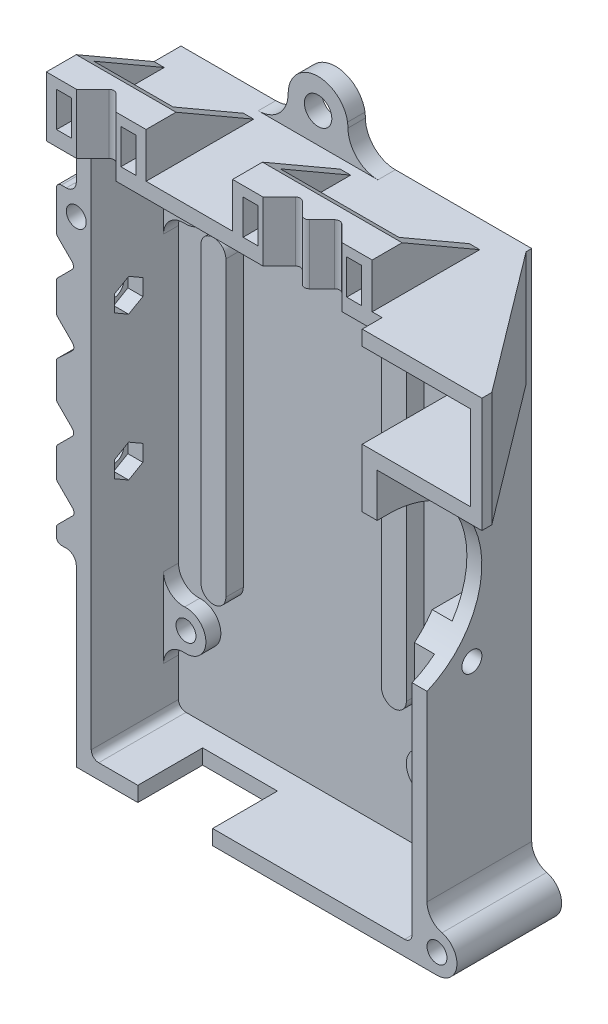
from build123d import *

# Parameters (mm, degrees)
BOSS_EXTRUDE1_DEPTH             = 21
BOSS_EXTRUDE2_DEPTH             = 3.5
BOSS_EXTRUDE3_DEPTH             = 21
CUT_EXTRUDE1_DEPTH              = 152.534444291
CUT_EXTRUDE1_DEPTH_BACK         = 152.534444291
SKETCH10_R                      = 2.750000171
SKETCH10_R_2                    = 1.99999852
BOSS_EXTRUDE4_DEPTH             = 7
SKETCH12_W                      = 20.722732544
SKETCH12_H                      = 16.999992371
BOSS_EXTRUDE5_DEPTH             = 29.86794
SKETCH11_3_W                    = 4.000002191
SKETCH11_3_H                    = 12
BOSS_EXTRUDE7_DEPTH             = 16.5
CUT_EXTRUDE2_DEPTH              = 152.049314388
SKETCH16_W                      = 5
SKETCH16_H                      = 16.999992371
BOSS_EXTRUDE9_DEPTH             = 3.5
CUT_EXTRUDE3_REACH              = 163.611
SKETCH11_4_R                    = 4.000002191
BOSS_EXTRUDE10_DEPTH            = 6.5
CUT_EXTRUDE5_DEPTH              = 161.9765096
CUT_EXTRUDE5_DEPTH_BACK         = 161.9765096
SKETCH20_R                      = 1.99999852
CUT_EXTRUDE6_START              = -7.000001
CUT_EXTRUDE6_DEPTH              = 7.000001
BOSS_EXTRUDE12_START            = -3.00000066
BOSS_EXTRUDE12_DEPTH            = 3.00000066
CUT_EXTRUDE7_REACH              = 152.189
SKETCH27_R                      = 1.999999364
CUT_EXTRUDE8_REACH              = 154.382
SKETCH29_W                      = 15.000001908
SKETCH29_H                      = 13
CUT_EXTRUDE10_START             = -3
SKETCH32_R                      = 1.99999852
CUT_EXTRUDE10_DEPTH             = 3
SKETCH34_R                      = 2.750000482
BOSS_EXTRUDE13_DEPTH            = 3.5
SKETCH36_W                      = 2.999998569
SKETCH36_H                      = 6.999977112
SKETCH36_W_2                    = 2.99999857
BOSS_EXTRUDE15_DEPTH            = 21.58846
SKETCH38_W                      = 23.798984527
SKETCH38_H                      = 6.999977112
SKETCH38_W_2                    = 15.899493694
CUT_EXTRUDE12_DEPTH             = 15.32436
CUT_EXTRUDE13_DEPTH             = 159.171800579
CUT_EXTRUDE14_REACH             = 171.467
SKETCH40_W                      = 23.798990726
SKETCH40_H                      = 2.000015259
SKETCH40_W_2                    = 15.899492264
CUT_EXTRUDE16_DEPTH             = 169.972465585
CUT_EXTRUDE16_DEPTH_BACK        = 2.999999
SKETCH41_R                      = 2.000001006
CUT_EXTRUDE17_REACH             = 163.611
CUT_EXTRUDE17_DIRECTION_2_REACH = 163.611
CUT_EXTRUDE18_START             = -3
SKETCH43_R                      = 1.999999364
SKETCH43_R_2                    = 1.99999852
CUT_EXTRUDE18_DEPTH             = 3
SKETCH44_R                      = 2.000001006
CUT_EXTRUDE19_DEPTH             = 3


with BuildPart() as part:
    # Sketch6 → Boss-Extrude1 (new body)
    with BuildSketch(Plane.XY):
        Polygon((4.000000477, 126.750007629), (4.000000477, 69.375003814), (6.999999046, 69.375003814), (6.999999046, 123.749992371), (71.349998474, 123.749992371), (71.349998474, 69.375003814), (74.349999134, 69.375003814), (74.349999134, 126.750007629), align=None)
        with BuildLine():
            Line((4.000000477, 69.375003814), (4.000000477, 12))
            Line((4.000000477, 12), (23, 12))
            Line((23, 12), (46.721875813, 12))
            ThreePointArc((46.721875813, 12), (47.010937855, 12.006954424), (47.299999897, 12))
            Line((47.299999897, 12), (76.349993277, 12))
            ThreePointArc((76.349993277, 12), (80.318124781, 15.495998665), (77.34998614, 19.873009894))
            ThreePointArc((77.34998614, 19.873009894), (75.187718222, 21.296490978), (74.349999134, 23.745965957))
            Line((74.349999134, 23.745965957), (74.349999134, 69.375003814))
            Line((74.349999134, 69.375003814), (71.349998474, 69.375003814))
            Line((71.349998474, 69.375003814), (71.349998474, 16.5))
            ThreePointArc((71.349998474, 16.5), (70.910658134, 15.439338592), (69.849996726, 14.999998252))
            Line((69.849996726, 14.999998252), (8.500000794, 14.999998252))
            ThreePointArc((8.500000794, 14.999998252), (7.439339386, 15.439338592), (6.999999046, 16.5))
            Line((6.999999046, 16.5), (6.999999046, 69.375003814))
            Line((6.999999046, 69.375003814), (4.000000477, 69.375003814))
        make_face()
    extrude(amount=BOSS_EXTRUDE1_DEPTH)

    # Sketch6<4> → Boss-Extrude2 (add)
    with BuildSketch(Plane.XY):
        with BuildLine():
            Line((46.721875813, 12), (23, 12))
            ThreePointArc((23, 12), (27.242640687, 10.242640687), (29, 6))
            ThreePointArc((29, 6), (34.999004884, 8.2e-08), (40.99999967, 5.998009768))
            ThreePointArc((40.99999967, 5.998009768), (42.660251426, 10.143654928), (46.721875813, 12))
        make_face()
        with BuildLine():
            Line((6.999999046, 123.749992371), (6.999999046, 16.5))
            ThreePointArc((6.999999046, 16.5), (7.439339386, 15.439338592), (8.500000794, 14.999998252))
            Line((8.500000794, 14.999998252), (69.849996726, 14.999998252))
            ThreePointArc((69.849996726, 14.999998252), (70.910658134, 15.439338592), (71.349998474, 16.5))
            Line((71.349998474, 16.5), (71.349998474, 123.749992371))
            Line((71.349998474, 123.749992371), (6.999999046, 123.749992371))
        make_face()
    extrude(amount=BOSS_EXTRUDE2_DEPTH)

    # Sketch9 → Boss-Extrude3 (add)
    with BuildSketch(Plane.XY):
        with BuildLine():
            Line((1.000000477, 111.59794588), (2.000000477, 111.59794588))
            ThreePointArc((2.000000477, 111.59794588), (3.414214039, 112.183732318), (4.000000477, 113.59794588))
            Line((4.000000477, 113.59794588), (4.000000477, 47))
            ThreePointArc((4.000000477, 47), (3.414209007, 48.414204361), (2.000000477, 48.999985766))
            Line((2.000000477, 48.999985766), (1.000000477, 48.999985766))
            ThreePointArc((1.000000477, 48.999985766), (0.292893696, 49.292878985), (4.77e-07, 49.999985766))
            Line((4.77e-07, 49.999985766), (4.77e-07, 51.585770678))
            ThreePointArc((4.77e-07, 51.585770678), (0.074219319, 51.963829729), (0.285858415, 52.285770678))
            Line((0.285858415, 52.285770678), (3.181543207, 55.181455471))
            ThreePointArc((3.181543207, 55.181455471), (3.535611584, 55.94485074), (3.181543207, 56.70824601))
            Line((3.181543207, 56.70824601), (0.283195204, 59.606594013))
            ThreePointArc((0.283195204, 59.606594013), (0.07163308, 59.932133116), (4.77e-07, 60.313712742))
            Line((4.77e-07, 60.313712742), (4.77e-07, 65.485286381))
            ThreePointArc((4.77e-07, 65.485286381), (0.081930249, 65.83661782), (0.283195204, 66.136015024))
            Line((0.283195204, 66.136015024), (3.181543207, 69.034363027))
            ThreePointArc((3.181543207, 69.034363027), (3.474333043, 69.74136641), (3.181543207, 70.448369793))
            Line((3.181543207, 70.448369793), (0.180917309, 73.448995691))
            ThreePointArc((0.180917309, 73.448995691), (0.012306014, 73.812584237), (4.77e-07, 74.213177514))
            Line((4.77e-07, 74.213177514), (4.77e-07, 80.384754968))
            ThreePointArc((4.77e-07, 80.384754968), (0.02955487, 80.738636823), (0.180917309, 81.059876985))
            Line((0.180917309, 81.059876985), (3.181543207, 83.899626586))
            ThreePointArc((3.181543207, 83.899626586), (3.50528427, 84.636290587), (3.181543207, 85.372954587))
            Line((3.181543207, 85.372954587), (0.180917309, 88.373580485))
            ThreePointArc((0.180917309, 88.373580485), (0.017422211, 88.725227692), (4.77e-07, 89.11263302))
            Line((4.77e-07, 89.11263302), (4.77e-07, 94.284195215))
            ThreePointArc((4.77e-07, 94.284195215), (0.017398622, 94.671662533), (0.180917309, 95.023365897))
            Line((0.180917309, 95.023365897), (3.181543207, 98.023991795))
            ThreePointArc((3.181543207, 98.023991795), (3.427018788, 98.680263767), (3.181543207, 99.336535739))
            Line((3.181543207, 99.336535739), (0.180917309, 102.337161637))
            ThreePointArc((0.180917309, 102.337161637), (0.029576956, 102.658343409), (4.77e-07, 103.012160968))
            Line((4.77e-07, 103.012160968), (4.77e-07, 110.59794588))
            ThreePointArc((4.77e-07, 110.59794588), (0.292893696, 111.305052661), (1.000000477, 111.59794588))
        make_face()
    extrude(amount=BOSS_EXTRUDE3_DEPTH)

    # Sketch10 → Cut-Extrude1 (cut, two sides: drawn at the far end of the back side and taken through both)
    with BuildSketch(Plane.XY.offset(-CUT_EXTRUDE1_DEPTH_BACK)):
        with Locations((34.999999893, 5.999999829)):
            Circle(SKETCH10_R)
        with Locations((59.700001725, 31.200001297)):
            Circle(SKETCH10_R_2)
        with Locations((76.349998476, 15.999999982)):
            Circle(SKETCH10_R_2)
        with Locations((11.500000477, 32.200000352)):
            Circle(SKETCH10_R_2)
        with Locations((3.99999967, 107.59797485)):
            Circle(SKETCH10_R_2)
        with Locations((11.500000477, 106.799995647)):
            Circle(SKETCH10_R_2)
        with Locations((34.999999893, 132.750000299)):
            Circle(SKETCH10_R)
        with Locations((59.700001725, 113.899995079)):
            Circle(SKETCH10_R_2)
    extrude(amount=CUT_EXTRUDE1_DEPTH + CUT_EXTRUDE1_DEPTH_BACK, mode=Mode.SUBTRACT)

    # Sketch11 → Boss-Extrude4 (add)
    with BuildSketch(Plane.XY):
        with BuildLine():
            Line((20.000006353, 101.249999523), (20.000006353, 42.5))
            ThreePointArc((20.000006353, 42.5), (17.500006353, 40), (15.000006353, 42.5))
            Line((15.000006353, 42.5), (15.000006353, 101.249999523))
            ThreePointArc((15.000006353, 101.249999523), (17.500006353, 103.749999523), (20.000006353, 101.249999523))
        make_face()
        with BuildLine():
            Line((56.199997425, 42.5), (56.199997425, 101.249999523))
            ThreePointArc((56.199997425, 101.249999523), (53.699997425, 103.749999523), (51.199997425, 101.249999523))
            Line((51.199997425, 101.249999523), (51.199997425, 42.5))
            ThreePointArc((51.199997425, 42.5), (53.699997425, 40), (56.199997425, 42.5))
        make_face()
    extrude(amount=BOSS_EXTRUDE4_DEPTH)

    # Sketch12 → Boss-Extrude5 (add)
    with BuildSketch(Plane.XY.offset(1.13206)):
        Polygon((71.349998474, 95), (71.349998474, 106.75), (93.100700378, 106.75), (93.100700378, 123.749992371), (71.349998474, 123.749992371), (71.349998474, 126.750007629), (95.349998474, 126.750007629), (95.349998474, 103.75), (74.349998474, 103.75), (74.349998474, 95), align=None)
        with Locations((82.739334106, 115.249996186)):
            Rectangle(SKETCH12_W, SKETCH12_H)
    extrude(amount=BOSS_EXTRUDE5_DEPTH)

    # Sketch11<3> → Boss-Extrude7 (add)
    with BuildSketch(Plane.XY):
        with Locations((69.349999569, 93)):
            Rectangle(SKETCH11_3_W, SKETCH11_3_H)
        with Locations((69.349999569, 61)):
            Rectangle(SKETCH11_3_W, SKETCH11_3_H)
    extrude(amount=BOSS_EXTRUDE7_DEPTH)

    # Sketch17 → Cut-Extrude2 (cut, through all)
    with BuildSketch(Plane(origin=(44.481818058, 0, -33.519447952), x_dir=(0.6018149521367547, 0, 0.79863556356115), z_dir=(-0.79863556356115, 0, 0.6018149521367547))):
        Polygon((80.787096013, 106.75), (80.787096013, 123.749992371), (68.315845718, 123.749992371), (67.697198387, 123.749992371), (44.462246624, 123.749992371), (44.462246624, 106.75), (67.697198387, 106.75), (68.315845718, 106.75), align=None)
    extrude(amount=CUT_EXTRUDE2_DEPTH, mode=Mode.SUBTRACT)

    # Sketch16 → Boss-Extrude9 (add)
    with BuildSketch(Plane.XY.offset(3.5)):
        with Locations((69.877967834, 115.249996186)):
            Rectangle(SKETCH16_W, SKETCH16_H)
    extrude(amount=-BOSS_EXTRUDE9_DEPTH)

    # Sketch18 → Cut-Extrude3 (cut, up to next)
    with BuildSketch(Plane(origin=(0, 126.750007629, 0), x_dir=(1, 0, 0), z_dir=(0, 1, 0)), mode=Mode.PRIVATE) as cut_extrude3_sk1:
        Polygon((95.349998474, -29), (74.349999134, -1.13206), (95.349998474, -1.13206), align=None)
    cut_extrude3_tool1 = extrude(cut_extrude3_sk1.sketch, amount=-CUT_EXTRUDE3_REACH, mode=Mode.PRIVATE) & part.part
    add(cut_extrude3_tool1.solids().sort_by_distance((88.349999, 126.750008, 10.421373))[0], mode=Mode.SUBTRACT)


with BuildPart() as boss_extrude10_tool:
    # Sketch11<4> → Boss-Extrude10 (new body)
    with BuildSketch(Plane.XY):
        with BuildLine():
            Line((7.000001972, 40.184359767), (7.000001972, 24.215635257))
            ThreePointArc((7.000001972, 24.215635257), (8.261395207, 27.131117809), (11.2500189, 28.207816384))
            ThreePointArc((11.2500189, 28.207816384), (15.500035829, 32.199997512), (11.2500189, 36.19217864))
            ThreePointArc((11.2500189, 36.19217864), (8.261395207, 37.268877215), (7.000001972, 40.184359767))
        make_face()
        with Locations((59.700001391, 31.20000078)):
            Circle(SKETCH11_4_R)
        with Locations((59.700001391, 113.900000509)):
            Circle(SKETCH11_4_R)
        with BuildLine():
            Line((7.000001972, 114.784361367), (7.000001972, 98.815636856))
            ThreePointArc((7.000001972, 98.815636856), (8.261395207, 101.731119408), (11.2500189, 102.807817984))
            ThreePointArc((11.2500189, 102.807817984), (15.500035829, 106.799999111), (11.2500189, 110.792180239))
            ThreePointArc((11.2500189, 110.792180239), (8.261395207, 111.868878814), (7.000001972, 114.784361367))
        make_face()
    extrude(amount=BOSS_EXTRUDE10_DEPTH)


with BuildPart() as part_1:
    add(part.part)


with BuildPart() as part_2:
    # Boss-Extrude10: joined with boss_extrude10_tool
    add(part_1.part.fuse(boss_extrude10_tool.part, tol=0.00001))

    # Sketch20 → Cut-Extrude5 (cut, two sides: drawn at the far end of the back side and taken through both)
    with BuildSketch(Plane.XY.offset(3.5).offset(-CUT_EXTRUDE5_DEPTH_BACK)):
        with Locations((11.500000477, 106.799995647)):
            Circle(SKETCH20_R)
        with Locations((11.500000477, 32.200000352)):
            Circle(SKETCH20_R)
        with Locations((59.700001725, 31.200001297)):
            Circle(SKETCH20_R)
        with Locations((59.700001725, 113.899995079)):
            Circle(SKETCH20_R)
    extrude(amount=CUT_EXTRUDE5_DEPTH + CUT_EXTRUDE5_DEPTH_BACK, mode=Mode.SUBTRACT)

    # Sketch23 → Cut-Extrude6 (cut)
    with BuildSketch(Plane(origin=(74.349999134, 0, 0), x_dir=(0, 0, -1), z_dir=(1, 0, 0)).offset(CUT_EXTRUDE6_START)):
        with BuildLine():
            Line((-31, 94.908846334), (-31, 23.654812291))
            Line((-31, 23.654812291), (-21, 23.654812291))
            Line((-21, 23.654812291), (-21, 60.32572408))
            ThreePointArc((-21, 60.32572408), (-10.000578453, 76.625954319), (-20.548913002, 93.221659139))
            ThreePointArc((-20.548913002, 93.221659139), (-25.662172256, 94.760784574), (-31, 94.908846334))
        make_face()
    extrude(amount=CUT_EXTRUDE6_DEPTH, mode=Mode.SUBTRACT)

    # Sketch25 → Boss-Extrude12 (add)
    with BuildSketch(Plane(origin=(74.349999134, 0, 0), x_dir=(0, 0, -1), z_dir=(1, 0, 0)).offset(BOSS_EXTRUDE12_START)):
        with BuildLine():
            ThreePointArc((-28.000590684, 95), (-24.429650305, 94.522367443), (-21, 93.419078343))
            Line((-21, 93.419078343), (-21, 95))
            Line((-21, 95), (-28.000590684, 95))
        make_face()
    extrude(amount=BOSS_EXTRUDE12_DEPTH)

    # Sketch27 → Cut-Extrude7 (cut, up to next)
    with BuildSketch(Plane(origin=(74.349999134, 0, 0), x_dir=(0, 0, -1), z_dir=(1, 0, 0)), mode=Mode.PRIVATE) as cut_extrude7_sk1:
        with Locations((-11.999999994, 92.999997362)):
            Circle(SKETCH27_R)
    cut_extrude7_tool1 = extrude(cut_extrude7_sk1.sketch, amount=-CUT_EXTRUDE7_REACH, mode=Mode.PRIVATE) & part_2.part
    # Sketch27 → Cut-Extrude7 (cut, up to next)
    with BuildSketch(Plane(origin=(74.349999134, 0, 0), x_dir=(0, 0, -1), z_dir=(1, 0, 0)), mode=Mode.PRIVATE) as cut_extrude7_sk2:
        with Locations((-11.999999994, 60.999997958)):
            Circle(SKETCH27_R)
    cut_extrude7_tool2 = extrude(cut_extrude7_sk2.sketch, amount=-CUT_EXTRUDE7_REACH, mode=Mode.PRIVATE) & part_2.part
    add(cut_extrude7_tool1.solids().sort_by_distance((74.349999, 92.999997, 12))[0], mode=Mode.SUBTRACT)
    add(cut_extrude7_tool2.solids().sort_by_distance((74.349999, 60.999998, 12))[0], mode=Mode.SUBTRACT)

    # Sketch29 → Cut-Extrude8 (cut, up to next)
    with BuildSketch(Plane.XZ.offset(-12), mode=Mode.PRIVATE) as cut_extrude8_sk1:
        with Locations((23.842785448, 14.5)):
            Rectangle(SKETCH29_W, SKETCH29_H)
    cut_extrude8_tool1 = extrude(cut_extrude8_sk1.sketch, amount=-CUT_EXTRUDE8_REACH, mode=Mode.PRIVATE) & part_2.part
    add(cut_extrude8_tool1.solids().sort_by_distance((23.842785, 12, 14.5))[0], mode=Mode.SUBTRACT)

    # Sketch32 → Cut-Extrude10 (cut)
    # profile 1 of 4: a face of its own
    with BuildSketch(Plane(origin=(0, 0, 0), x_dir=(-1, 0, 0), z_dir=(0, 0, -1)).offset(CUT_EXTRUDE10_START)):
        Polygon((-14.349997941, 33.845447155), (-14.349997941, 30.554553548), (-11.500000477, 28.909106745), (-8.650003013, 30.554553548), (-8.650003013, 33.845447155), (-11.500000477, 35.490893958), align=None)
        with Locations(Location((-11.500000477, 32.200000352, 0), (0, 0, 180))):
            Circle(SKETCH32_R, mode=Mode.SUBTRACT)
    # profile 2 of 4: a face of its own
    with BuildSketch(Plane(origin=(0, 0, 0), x_dir=(-1, 0, 0), z_dir=(0, 0, -1)).offset(CUT_EXTRUDE10_START)):
        Polygon((-62.549999189, 32.8454481), (-62.549999189, 29.554554494), (-59.700001725, 27.90910769), (-56.85000426, 29.554554494), (-56.85000426, 32.8454481), (-59.700001725, 34.490894903), align=None)
        with Locations(Location((-59.700001725, 31.200001297, 0), (0, 0, 180))):
            Circle(SKETCH32_R, mode=Mode.SUBTRACT)
    # profile 3 of 4: a face of its own
    with BuildSketch(Plane(origin=(0, 0, 0), x_dir=(-1, 0, 0), z_dir=(0, 0, -1)).offset(CUT_EXTRUDE10_START)):
        Polygon((-62.549999189, 115.545441882), (-62.549999189, 112.254548275), (-59.700001725, 110.609101472), (-56.85000426, 112.254548275), (-56.85000426, 115.545441882), (-59.700001725, 117.190888685), align=None)
        with Locations(Location((-59.700001725, 113.899995079, 0), (0, 0, 180))):
            Circle(SKETCH32_R, mode=Mode.SUBTRACT)
    # profile 4 of 4: a face of its own
    with BuildSketch(Plane(origin=(0, 0, 0), x_dir=(-1, 0, 0), z_dir=(0, 0, -1)).offset(CUT_EXTRUDE10_START)):
        Polygon((-14.349997941, 108.44544245), (-14.349997941, 105.154548844), (-11.500000477, 103.50910204), (-8.650003013, 105.154548844), (-8.650003013, 108.44544245), (-11.500000477, 110.090889253), align=None)
        with Locations(Location((-11.500000477, 106.799995647, 0), (0, 0, 180))):
            Circle(SKETCH32_R, mode=Mode.SUBTRACT)
    extrude(amount=CUT_EXTRUDE10_DEPTH, mode=Mode.SUBTRACT)

    # Sketch34 → Boss-Extrude13 (add)
    with BuildSketch(Plane(origin=(0, 0, 0), x_dir=(-1, 0, 0), z_dir=(0, 0, -1))):
        with BuildLine():
            Line((-40.918188018, 133.737564048), (-41.000003815, 132.750003815))
            ThreePointArc((-41.000003815, 132.750003815), (-42.75736201, 128.507365825), (-47, 126.750007629))
            Line((-47, 126.750007629), (-23, 126.750007629))
            ThreePointArc((-23, 126.750007629), (-27.238674937, 128.503406471), (-28.999985725, 132.738799844))
            ThreePointArc((-28.999985725, 132.738799844), (-34.500663243, 138.708527718), (-40.918188018, 133.737564048))
        make_face()
        with Locations((-35.000000683, 132.750003815)):
            Circle(SKETCH34_R, mode=Mode.SUBTRACT)
    extrude(amount=-BOSS_EXTRUDE13_DEPTH)

    # Sketch36 → Boss-Extrude15 (add)
    with BuildSketch(Plane.XY.offset(5.41154)):
        Polygon((41.349998474, 135.75), (69.349998474, 135.75), (69.349998474, 126.750007629), (71.349998474, 126.750007629), (71.349998474, 123.749992371), (4.000000477, 123.749992371), (4.000000477, 135.75), (24.000000477, 135.75), (24.000000477, 126.750007629), (41.349998474, 126.750007629), align=None)
        with Locations((65.749495744, 130.249996185)):
            Rectangle(SKETCH36_W, SKETCH36_H, mode=Mode.SUBTRACT)
        with Locations((44.950503588, 130.249996185)):
            Rectangle(SKETCH36_W, SKETCH36_H, mode=Mode.SUBTRACT)
        with Locations((20.449746371, 130.249996185)):
            Rectangle(SKETCH36_W, SKETCH36_H, mode=Mode.SUBTRACT)
        with Locations((7.550252676, 130.249996185)):
            Rectangle(SKETCH36_W_2, SKETCH36_H, mode=Mode.SUBTRACT)
    extrude(amount=BOSS_EXTRUDE15_DEPTH)

    # Sketch38 → Cut-Extrude12 (cut)
    with BuildSketch(Plane(origin=(0, 0, 5.41154), x_dir=(-1, 0, 0), z_dir=(0, 0, -1))):
        with Locations((-55.349988938, 130.249996185)):
            Rectangle(SKETCH38_W, SKETCH38_H)
        with Locations((-13.999992609, 130.249996185)):
            Rectangle(SKETCH38_W_2, SKETCH38_H)
    extrude(amount=-CUT_EXTRUDE12_DEPTH, mode=Mode.SUBTRACT)

    # Sketch39 → Cut-Extrude13 (cut, through all)
    with BuildSketch(Plane(origin=(69.349998474, 0, 0), x_dir=(0, 0, -1), z_dir=(1, 0, 0))):
        Polygon((-5.41154, 135.75), (-20.999984054, 135.75), (-5.41154, 126.750007629), align=None)
    extrude(amount=-CUT_EXTRUDE13_DEPTH, mode=Mode.SUBTRACT)

    # Sketch40 → Cut-Extrude14 (cut, up to next)
    with BuildSketch(Plane(origin=(0, 0, 19.5359), x_dir=(-1, 0, 0), z_dir=(0, 0, -1)), mode=Mode.PRIVATE) as cut_extrude14_sk1:
        with Locations((-55.349999666, 134.749992371)):
            Rectangle(SKETCH40_W, SKETCH40_H)
    cut_extrude14_tool1 = extrude(cut_extrude14_sk1.sketch, amount=CUT_EXTRUDE14_REACH, mode=Mode.PRIVATE) & part_2.part
    # Sketch40 → Cut-Extrude14 (cut, up to next)
    with BuildSketch(Plane(origin=(0, 0, 19.5359), x_dir=(-1, 0, 0), z_dir=(0, 0, -1)), mode=Mode.PRIVATE) as cut_extrude14_sk2:
        with Locations((-13.999999523, 134.749992371)):
            Rectangle(SKETCH40_W_2, SKETCH40_H)
    cut_extrude14_tool2 = extrude(cut_extrude14_sk2.sketch, amount=CUT_EXTRUDE14_REACH, mode=Mode.PRIVATE) & part_2.part
    add(cut_extrude14_tool1.solids().sort_by_distance((55.35, 134.749992, 19.5359))[0], mode=Mode.SUBTRACT)
    add(cut_extrude14_tool2.solids().sort_by_distance((14, 134.749992, 19.5359))[0], mode=Mode.SUBTRACT)

    # Sketch41 → Cut-Extrude16 (cut, two sides: drawn at the far end of the back side and taken through both)
    with BuildSketch(Plane.ZY.offset(-4.000000477).offset(-CUT_EXTRUDE16_DEPTH_BACK)):
        with Locations((13.499999786, 91.69848037)):
            Circle(SKETCH41_R)
        with Locations((13.499999786, 62.899494736)):
            Circle(SKETCH41_R)
    extrude(amount=CUT_EXTRUDE16_DEPTH + CUT_EXTRUDE16_DEPTH_BACK, mode=Mode.SUBTRACT)

    # Sketch42 → Cut-Extrude17 (cut, up to next)
    with BuildSketch(Plane(origin=(0, 126.750007629, 0), x_dir=(1, 0, 0), z_dir=(0, 1, 0)), mode=Mode.PRIVATE) as cut_extrude17_sk1:
        with BuildLine():
            Line((52.107347409, -23.757358436), (54.642882142, -26.292893169))
            ThreePointArc((54.642882142, -26.292893169), (55.349985522, -26.585782987), (56.057088902, -26.292893169))
            Line((56.057088902, -26.292893169), (58.592623636, -23.757358436))
            ThreePointArc((58.592623636, -23.757358436), (59.299737416, -23.464458218), (60.006851196, -23.757358436))
            Line((60.006851196, -23.757358436), (63.24949276, -27))
            Line((63.24949276, -27), (47.450496628, -27))
            Line((47.450496628, -27), (50.693138192, -23.757358436))
            ThreePointArc((50.693138192, -23.757358436), (51.4002428, -23.46446739), (52.107347409, -23.757358436))
        make_face()
    cut_extrude17_tool1 = extrude(cut_extrude17_sk1.sketch, amount=-CUT_EXTRUDE17_REACH, mode=Mode.PRIVATE) & part_2.part
    # Sketch42 → Cut-Extrude17 (cut, up to next)
    with BuildSketch(Plane(origin=(0, 126.750007629, 0), x_dir=(1, 0, 0), z_dir=(0, 1, 0)), mode=Mode.PRIVATE) as cut_extrude17_sk2:
        with BuildLine():
            Line((14.707105568, -23.757358436), (17.949747132, -27))
            Line((17.949747132, -27), (10.050251961, -27))
            Line((10.050251961, -27), (13.292893525, -23.757358436))
            ThreePointArc((13.292893525, -23.757358436), (13.999999546, -23.464465977), (14.707105568, -23.757358436))
        make_face()
    cut_extrude17_tool2 = extrude(cut_extrude17_sk2.sketch, amount=-CUT_EXTRUDE17_REACH, mode=Mode.PRIVATE) & part_2.part
    add(cut_extrude17_tool1.solids().sort_by_distance((53.260636, 126.750008, 25.139605))[0], mode=Mode.SUBTRACT)
    add(cut_extrude17_tool2.solids().sort_by_distance((14, 126.750008, 25.715739))[0], mode=Mode.SUBTRACT)

    # Sketch42 → Cut-Extrude17 direction 2 (cut, up to next)
    with BuildSketch(Plane(origin=(0, 126.750007629, 0), x_dir=(1, 0, 0), z_dir=(0, 1, 0)), mode=Mode.PRIVATE) as cut_extrude17_direction_2_sk1:
        with BuildLine():
            Line((52.107347409, -23.757358436), (54.642882142, -26.292893169))
            ThreePointArc((54.642882142, -26.292893169), (55.349985522, -26.585782987), (56.057088902, -26.292893169))
            Line((56.057088902, -26.292893169), (58.592623636, -23.757358436))
            ThreePointArc((58.592623636, -23.757358436), (59.299737416, -23.464458218), (60.006851196, -23.757358436))
            Line((60.006851196, -23.757358436), (63.24949276, -27))
            Line((63.24949276, -27), (47.450496628, -27))
            Line((47.450496628, -27), (50.693138192, -23.757358436))
            ThreePointArc((50.693138192, -23.757358436), (51.4002428, -23.46446739), (52.107347409, -23.757358436))
        make_face()
    cut_extrude17_direction_2_tool1 = extrude(cut_extrude17_direction_2_sk1.sketch, amount=CUT_EXTRUDE17_DIRECTION_2_REACH, mode=Mode.PRIVATE) & part_2.part
    # Sketch42 → Cut-Extrude17 direction 2 (cut, up to next)
    with BuildSketch(Plane(origin=(0, 126.750007629, 0), x_dir=(1, 0, 0), z_dir=(0, 1, 0)), mode=Mode.PRIVATE) as cut_extrude17_direction_2_sk2:
        with BuildLine():
            Line((14.707105568, -23.757358436), (17.949747132, -27))
            Line((17.949747132, -27), (10.050251961, -27))
            Line((10.050251961, -27), (13.292893525, -23.757358436))
            ThreePointArc((13.292893525, -23.757358436), (13.999999546, -23.464465977), (14.707105568, -23.757358436))
        make_face()
    cut_extrude17_direction_2_tool2 = extrude(cut_extrude17_direction_2_sk2.sketch, amount=CUT_EXTRUDE17_DIRECTION_2_REACH, mode=Mode.PRIVATE) & part_2.part
    add(cut_extrude17_direction_2_tool1.solids().sort_by_distance((53.260636, 126.750008, 25.139605))[0], mode=Mode.SUBTRACT)
    add(cut_extrude17_direction_2_tool2.solids().sort_by_distance((14, 126.750008, 25.715739))[0], mode=Mode.SUBTRACT)

    # Sketch43 → Cut-Extrude18 (cut)
    # profile 1 of 2: a face of its own
    with BuildSketch(Plane.ZY.offset(-67.349998474).offset(CUT_EXTRUDE18_START)):
        Polygon((9.150002529, 62.645444761), (9.150002529, 59.354551154), (11.999999994, 57.709104351), (14.849997458, 59.354551154), (14.849997458, 62.645444761), (11.999999994, 64.290891564), align=None)
        with Locations(Location((11.999999994, 60.999997958, 0), (0, 0, 180))):
            Circle(SKETCH43_R, mode=Mode.SUBTRACT)
    # profile 2 of 2: a face of its own
    with BuildSketch(Plane.ZY.offset(-67.349998474).offset(CUT_EXTRUDE18_START)):
        Polygon((9.150002529, 94.645444165), (9.150002529, 91.354550559), (11.999999994, 89.709103756), (14.849997458, 91.354550559), (14.849997458, 94.645444165), (11.999999994, 96.290890969), align=None)
        with Locations(Location((11.999999994, 92.999997362, 0), (0, 0, 180))):
            Circle(SKETCH43_R_2, mode=Mode.SUBTRACT)
    extrude(amount=CUT_EXTRUDE18_DEPTH, mode=Mode.SUBTRACT)

    # Sketch44 → Cut-Extrude19 (cut)
    # profile 1 of 2: a face of its own
    with BuildSketch(Plane(origin=(6.999999046, 0, 0), x_dir=(0, 0, -1), z_dir=(1, 0, 0))):
        Polygon((-16.349997251, 64.54494154), (-16.349997251, 61.254047933), (-13.499999786, 59.60860113), (-10.650002322, 61.254047933), (-10.650002322, 64.54494154), (-13.499999786, 66.190388343), align=None)
        with Locations((-13.499999786, 62.899494736)):
            Circle(SKETCH44_R, mode=Mode.SUBTRACT)
    # profile 2 of 2: a face of its own
    with BuildSketch(Plane(origin=(6.999999046, 0, 0), x_dir=(0, 0, -1), z_dir=(1, 0, 0))):
        Polygon((-16.349997251, 93.343927173), (-16.349997251, 90.053033567), (-13.499999786, 88.407586764), (-10.650002322, 90.053033567), (-10.650002322, 93.343927173), (-13.499999786, 94.989373977), align=None)
        with Locations((-13.499999786, 91.69848037)):
            Circle(SKETCH44_R, mode=Mode.SUBTRACT)
    extrude(amount=-CUT_EXTRUDE19_DEPTH, mode=Mode.SUBTRACT)


solid = part_2.part
